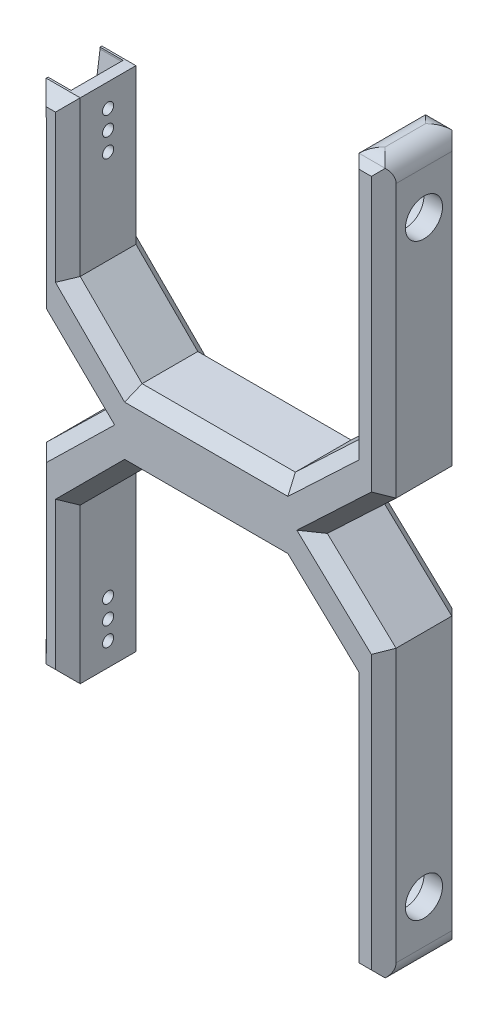
from build123d import *

# Parameters (mm, degrees)
EXTRUDE_3_DEPTH          = 13
CUT_EXTRUDE_1_DEPTH      = 10
CUT_EXTRUDE_1_DEPTH_BACK = 3.5
SKETCH_5_R               = 0.9
CUT_EXTRUDE_2_DEPTH      = 3.9
SKETCH_7_R               = 4.1
CUT_EXTRUDE_3_DEPTH      = 3
SKETCH_8_R               = 3
CUT_EXTRUDE_4_DEPTH      = 10
CHAMFER_1_SIZE           = 2
FILLET_1_R               = 3


with BuildPart() as part:
    # Эскиз3 → Бобышка-Вытянуть3 (new body)
    with BuildSketch(Plane.XY):
        Polygon((37, -6.101609525), (31, -6.101609525), (31, 35.715183329), (20.718431003, 45.425453097), (-4.040001338, 45.425453097), (-14.040001338, 35.425453097), (-14.040001338, 10.425453097), (-19.540001338, 10.425453097), (-19.457025681, 41.54590709), (-9.338005437, 51.425453097), (-19.457025681, 61.304999103), (-19.540001338, 92.425453097), (-14.040001338, 92.425453097), (-14.040001338, 67.425453097), (-4.040001338, 57.425453097), (20.718431003, 57.425453097), (31, 67.135722864), (31, 108.952515718), (37, 108.952515718), (37, 61.925453097), (25.882237358, 51.425453097), (37, 40.925453097), align=None)
    extrude(amount=EXTRUDE_3_DEPTH)

    # Эскиз4 → Вырез-Вытянуть1 (cut, two sides: drawn at the far end of the back side and taken through both)
    with BuildSketch(Plane(origin=(-19.567659345, 0.052172741, 0), x_dir=(0, 0, 1), z_dir=(-0.9999964455104726, 0.0026662645068428353, 0)).offset(-CUT_EXTRUDE_1_DEPTH_BACK)):
        with BuildLine():
            Line((2.257723781, 10.373317227), (10.742275161, 10.373317227))
            Line((10.742275161, 10.373317227), (9.300003079, 20.36302214))
            ThreePointArc((9.300003079, 20.36302214), (6.5, 23.163025219), (3.699996921, 20.36302214))
            Line((3.699996921, 20.36302214), (2.257723781, 10.373317227))
        make_face()
        with BuildLine():
            Line((10.701924393, 92.093833026), (9.300003079, 82.383612315))
            ThreePointArc((9.300003079, 82.383612315), (6.5, 79.583609236), (3.699996921, 82.383612315))
            Line((3.699996921, 82.383612315), (2.298075607, 92.093833026))
            Line((2.298075607, 92.093833026), (2.298075607, 92.652801429))
            Line((2.298075607, 92.652801429), (10.701924393, 92.652801429))
            Line((10.701924393, 92.652801429), (10.701924393, 92.093833026))
        make_face()
    extrude(amount=CUT_EXTRUDE_1_DEPTH + CUT_EXTRUDE_1_DEPTH_BACK, mode=Mode.SUBTRACT)

    # Эскиз5 → Вырез-Вытянуть2 (cut)
    with BuildSketch(Plane(origin=(-16.067671786, 0.042840815, 0), x_dir=(0, 0, 1), z_dir=(-0.9999964455104726, 0.0026662645068428353, 0))):
        with Locations(Location((6.5, 20.250905412, 0), (0, 0, 270))):
            Circle(SKETCH_5_R)
        with Locations(Location((6.5, 17.200915994, 0), (0, 0, 270))):
            Circle(SKETCH_5_R)
        with Locations(Location((6.5, 14.150926575, 0), (0, 0, 270))):
            Circle(SKETCH_5_R)
        with Locations(Location((6.5, 88.64981885, 0), (0, 0, 90))):
            Circle(SKETCH_5_R)
        with Locations(Location((6.5, 85.599829432, 0), (0, 0, 90))):
            Circle(SKETCH_5_R)
        with Locations(Location((6.5, 82.549840014, 0), (0, 0, 90))):
            Circle(SKETCH_5_R)
    extrude(amount=-CUT_EXTRUDE_2_DEPTH, mode=Mode.SUBTRACT)

    # Эскиз7 → Вырез-Вытянуть3 (cut)
    with BuildSketch(Plane.ZY.offset(-31)):
        with Locations(Location((6.5, 3.89666543, 0), (0, 0, 270))):
            Circle(SKETCH_7_R)
        with Locations(Location((6.5, 98.954240763, 0), (0, 0, 90))):
            Circle(SKETCH_7_R)
    extrude(amount=-CUT_EXTRUDE_3_DEPTH, mode=Mode.SUBTRACT)

    # Эскиз8 → Вырез-Вытянуть4 (cut)
    with BuildSketch(Plane.ZY.offset(-34)):
        with Locations(Location((6.5, 3.89666543, 0), (0, 0, 270))):
            Circle(SKETCH_8_R)
        with Locations((6.5, 98.954240763)):
            Circle(SKETCH_8_R)
    extrude(amount=-CUT_EXTRUDE_4_DEPTH, mode=Mode.SUBTRACT)

    # Фаска1
    chamfer_1_edges = [part.edges().sort_by_distance(p)[0] for p in [
        (25.859215501, 40.570318213, 13),
        (31, 14.806786902, 13),
        (34, -6.101609525, 13),
        (-14.040001338, 22.925453097, 0),
        (37, 17.411921786, 13),
        (-16.790001338, 10.425453097, 0),
        (-19.498513509, 25.985680093, 0),
        (-14.397515559, 46.485680093, 0),
        (-14.397515559, 56.3652261, 0),
        (-19.498513509, 76.8652261, 0),
        (-16.790001338, 92.425453097, 0),
        (-14.040001338, 79.925453097, 0),
        (31.441118679, 46.175453097, 13),
        (-9.040001338, 62.425453097, 0),
        (8.339214833, 57.425453097, 0),
        (25.859215501, 62.28058798, 0),
        (31, 88.044119291, 0),
        (34, 108.952515718, 0),
        (37, 85.438984407, 0),
        (31.441118679, 56.675453097, 0),
        (31.441118679, 46.175453097, 0),
        (31.441118679, 56.675453097, 13),
        (37, 17.411921786, 0),
        (34, -6.101609525, 0),
        (31, 14.806786902, 0),
        (25.859215501, 40.570318213, 0),
        (8.339214833, 45.425453097, 0),
        (-9.040001338, 40.425453097, 0),
        (37, 85.438984407, 13),
        (34, 108.952515718, 13),
        (31, 88.044119291, 13),
        (25.859215501, 62.28058798, 13),
        (-9.040001338, 40.425453097, 13),
        (8.339214833, 57.425453097, 13),
        (-9.040001338, 62.425453097, 13),
        (-14.040001338, 79.925453097, 13),
        (-16.790001338, 92.425453097, 13),
        (-19.498513509, 76.8652261, 13),
        (-14.397515559, 56.3652261, 13),
        (-14.397515559, 46.485680093, 13),
        (-19.498513509, 25.985680093, 13),
        (-16.790001338, 10.425453097, 13),
        (-14.040001338, 22.925453097, 13),
        (8.339214833, 45.425453097, 13),
    ]]
    chamfer(chamfer_1_edges, length=CHAMFER_1_SIZE)

    # Скругление1
    # the kernel refuses this fillet: 3 mm, written as the material it takes off along each edge
    with BuildSketch(Plane(origin=(31, 108.952515718, -5.5), x_dir=(1, 0, 0), z_dir=(0, 0, 1)), Plane(origin=(37, 108.952515718, -5.5), x_dir=(0, -1, 0), z_dir=(0, 0, 1)), Plane(origin=(37, -6.101609525, -5.5), x_dir=(-1, 0, 0), z_dir=(0, 0, 1))) as fillet_1_piece_1:
        with BuildLine():
            CenterArc((FILLET_1_R, -FILLET_1_R), FILLET_1_R, 90, 90)
            Line((0, -FILLET_1_R), (0, 0))
            Line((0, 0), (FILLET_1_R, 0))
        make_face()
    extrude(amount=24, mode=Mode.SUBTRACT)
    with BuildSketch(Plane(origin=(27.893398282, 108.952515718, 2), x_dir=(0, -0.7071067811865495, -0.7071067811865456), z_dir=(1, 0, 0)), Plane(origin=(40.106601718, -6.101609525, 11), x_dir=(0, 0, -1), z_dir=(-1, 0, 0))) as fillet_1_piece_2:
        with BuildLine():
            CenterArc((FILLET_1_R * 0.414213562373, -FILLET_1_R), FILLET_1_R, 90, 45)
            Line((-FILLET_1_R * 0.292893218813, -FILLET_1_R * 0.292893218813), (0, 0))
            Line((0, 0), (FILLET_1_R * 0.414213562373, 0))
        make_face()
    extrude(amount=12.213203436, mode=Mode.SUBTRACT)
    with BuildSketch(Plane(origin=(27.893398282, 108.952515718, 11), x_dir=(0, -0.7071067811865481, 0.7071067811865467), z_dir=(1, 0, 0)), Plane(origin=(40.106601718, -6.101609525, 2), x_dir=(0, 0, 1), z_dir=(-1, 0, 0))) as fillet_1_piece_3:
        with BuildLine():
            CenterArc((FILLET_1_R * 0.414213562373, FILLET_1_R), FILLET_1_R, 225, 45)
            Line((-FILLET_1_R * 0.292893218813, FILLET_1_R * 0.292893218813), (0, 0))
            Line((0, 0), (FILLET_1_R * 0.414213562373, 0))
        make_face()
    extrude(amount=12.213203436, mode=Mode.SUBTRACT)
    with BuildSketch(Plane(origin=(31, -6.101609525, -5.5), x_dir=(1, 0, 0), z_dir=(0, 0, 1))) as fillet_1_piece_4:
        with BuildLine():
            CenterArc((FILLET_1_R, FILLET_1_R), FILLET_1_R, 180, 90)
            Line((0, FILLET_1_R), (0, 0))
            Line((0, 0), (FILLET_1_R, 0))
        make_face()
    extrude(amount=24, mode=Mode.SUBTRACT)


solid = part.part
